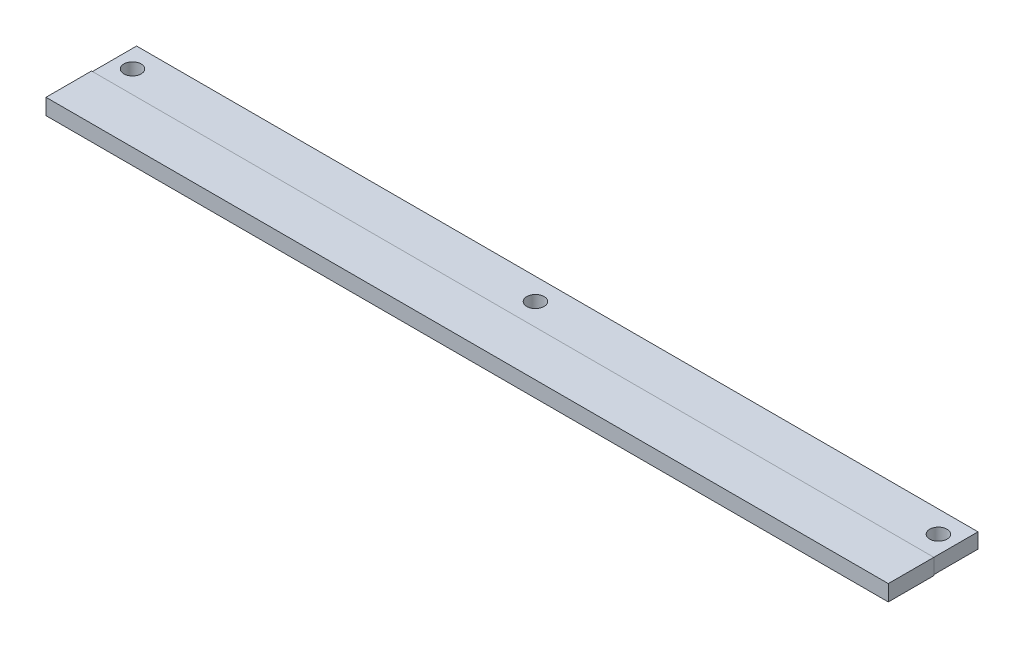
from build123d import *

# Parameters (mm, degrees)
SKETCH1_W           = 3.5
SKETCH1_H           = 185
BOSS_EXTRUDE1_DEPTH = 20
CUT_EXTRUDE1_REACH  = 188.111
SKETCH2_R           = 1.9
LPATTERN1_COUNT     = 3
LPATTERN1_PITCH     = 88.5
SKETCH3_W           = 185
SKETCH3_H           = 3.5
SKETCH3_W_2         = 184.8
SKETCH3_H_2         = 3.3
CUT_EXTRUDE2_DEPTH  = 10
CUT_EXTRUDE3_REACH  = 188.109
SKETCH5_W           = 184.8
SKETCH5_H           = 0.2


with BuildPart() as part:
    # Sketch1 → Boss-Extrude1 (new body)
    with BuildSketch(Plane(origin=(0, 0, 0), x_dir=(0, 1, 0), z_dir=(0, 0, 1))):
        with Locations((1.75, 92.5)):
            Rectangle(SKETCH1_W, SKETCH1_H)
    extrude(amount=BOSS_EXTRUDE1_DEPTH)

    # Sketch2 → Cut-Extrude1 (cut, up to next)
    with BuildSketch(Plane(origin=(0, 3.5, 0), x_dir=(-1, 0, 0), z_dir=(0, 1, 0)), mode=Mode.PRIVATE) as cut_extrude1_sk1:
        with Locations((181, 5)):
            Circle(SKETCH2_R)
    cut_extrude1_tool1 = extrude(cut_extrude1_sk1.sketch, amount=-CUT_EXTRUDE1_REACH, mode=Mode.PRIVATE) & part.part
    cut_extrude1 = cut_extrude1_tool1.solids().sort_by_distance((-181, 3.5, 5))[0]
    add(cut_extrude1, mode=Mode.SUBTRACT)

    # LPattern1: Cut-Extrude1 ×3
    with Locations(*[(i * LPATTERN1_PITCH, 0, 0) for i in range(1, LPATTERN1_COUNT)]):
        add(cut_extrude1, mode=Mode.SUBTRACT)

    # Sketch3 → Cut-Extrude2 (cut)
    with BuildSketch(Plane(origin=(0, 0, 0), x_dir=(1, 0, 0), z_dir=(0, 0, -1))):
        with Locations((-92.5, -1.75)):
            Rectangle(SKETCH3_W, SKETCH3_H)
        with Locations((-92.5, -1.75)):
            Rectangle(SKETCH3_W_2, SKETCH3_H_2, mode=Mode.SUBTRACT)
    extrude(amount=-CUT_EXTRUDE2_DEPTH, mode=Mode.SUBTRACT)

    # Sketch5 → Cut-Extrude3 (cut, up to next)
    with BuildSketch(Plane(origin=(0, 3.4, 0), x_dir=(-1, 0, 0), z_dir=(0, 1, 0)), mode=Mode.PRIVATE) as cut_extrude3_sk1:
        with Locations((92.5, 0.1)):
            Rectangle(SKETCH5_W, SKETCH5_H)
    cut_extrude3_tool1 = extrude(cut_extrude3_sk1.sketch, amount=-CUT_EXTRUDE3_REACH, mode=Mode.PRIVATE) & part.part
    add(cut_extrude3_tool1.solids().sort_by_distance((-92.5, 3.4, 0.1))[0], mode=Mode.SUBTRACT)


solid = part.part
